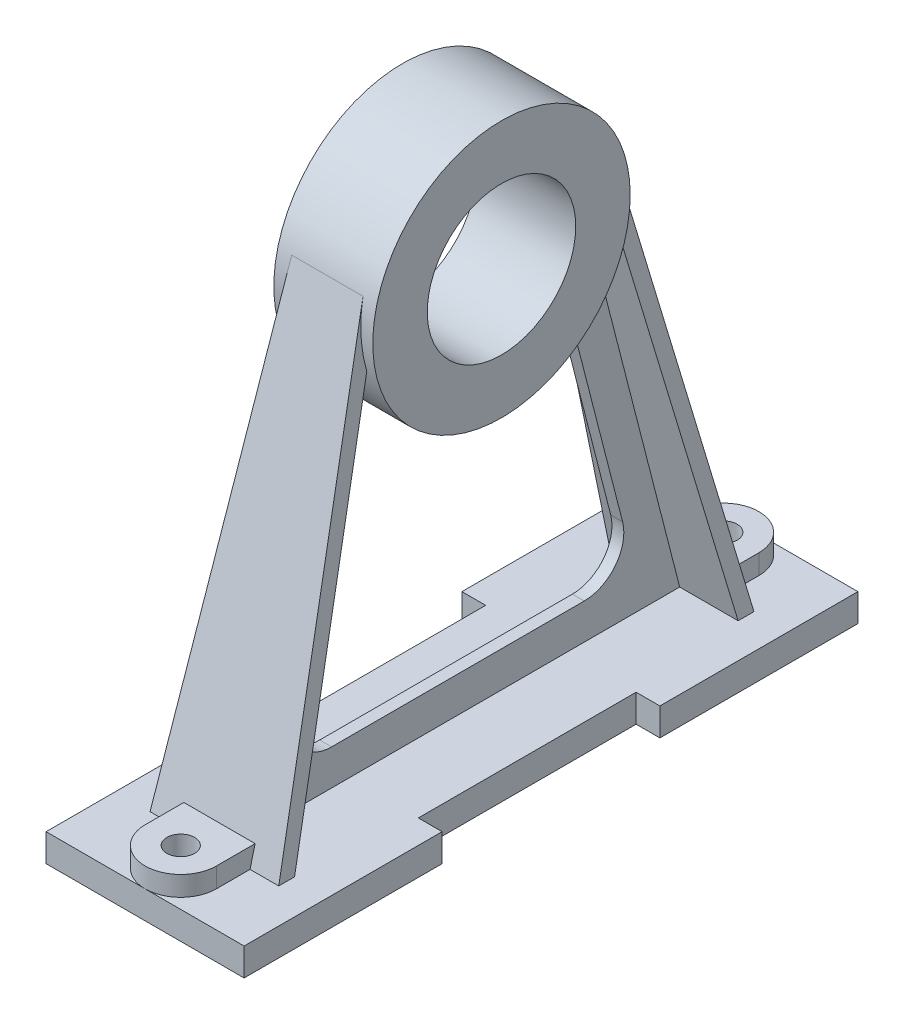
from build123d import *

# Parameters (mm, degrees)
SKETCH1_W             = 100
SKETCH1_H             = 14
BOSS_EXTRUDE1_DEPTH   = 310
SKETCH2_W             = 12
SKETCH2_H             = 110
CUT_EXTRUDE1_DEPTH    = 315.318309998
SKETCH3_R             = 65
SKETCH3_R_2           = 37.5
BOSS_EXTRUDE2_DEPTH   = 25
BOSS_EXTRUDE4_DEPTH   = 3
FILLET1_R             = 20
BOSS_EXTRUDE5_REACH   = 338.253
BOSS_EXTRUDE6_REACH   = 338.253
SKETCH8_R             = 7
BOSS_EXTRUDE7_DEPTH   = 10
BOSS_EXTRUDE8_REACH   = 401.187
SKETCH9_W             = 36
SKETCH9_H             = 10
BOSS_EXTRUDE9_REACH   = 401.187
SKETCH10_W            = 36
SKETCH10_H            = 10
M6_TAPPED_HOLE1_D     = 5
M6_TAPPED_HOLE1_DEPTH = 12


with BuildPart() as part:
    # Sketch1 → Boss-Extrude1 (new body)
    with BuildSketch(Plane.XY):
        with Locations((0, 7)):
            Rectangle(SKETCH1_W, SKETCH1_H)
    extrude(amount=-BOSS_EXTRUDE1_DEPTH)

    # Sketch2 → Cut-Extrude1 (cut, through all)
    with BuildSketch(Plane(origin=(0, 14, 0), x_dir=(1, 0, 0), z_dir=(0, 1, 0))):
        with Locations((44, 155)):
            Rectangle(SKETCH2_W, SKETCH2_H)
        with Locations((-44, 155)):
            Rectangle(SKETCH2_W, SKETCH2_H)
    extrude(amount=-CUT_EXTRUDE1_DEPTH, mode=Mode.SUBTRACT)



with BuildPart() as body_2:
    # Sketch3 → Boss-Extrude2 (new, symmetric)
    with BuildSketch(Plane(origin=(0, 0, 0), x_dir=(0, 0, -1), z_dir=(1, 0, 0))):
        with Locations((155, 220)):
            Circle(SKETCH3_R)
        with Locations((155, 220)):
            Circle(SKETCH3_R_2, mode=Mode.SUBTRACT)
    extrude(amount=BOSS_EXTRUDE2_DEPTH, both=True)


with BuildPart() as part_1:
    add(part.part)

    add(body_2.part)  # Boss-Extrude4 merges body 2
    # Sketch4 → Boss-Extrude4 (add, symmetric)
    with BuildSketch(Plane(origin=(0, 0, 0), x_dir=(0, 0, -1), z_dir=(1, 0, 0))):
        with BuildLine():
            Line((35, 14), (92.042084842, 236.164804946))
            ThreePointArc((92.042084842, 236.164804946), (91.329913301, 206.918713377), (103.515132178, 180.322444817))
            Line((103.515132178, 180.322444817), (65.432495807, 32))
            Line((65.432495807, 32), (244.567504193, 32))
            Line((244.567504193, 32), (206.484867822, 180.322444817))
            ThreePointArc((206.484867822, 180.322444817), (218.670086699, 206.918713377), (217.957915158, 236.164804946))
            Line((217.957915158, 236.164804946), (275, 14))
            Line((275, 14), (35, 14))
        make_face()
    extrude(amount=BOSS_EXTRUDE4_DEPTH, both=True)

    # Fillet1
    fillet1_edges = [part_1.edges().sort_by_distance(p)[0] for p in [
        (0, 32, -65.432495807),
        (0, 32, -244.567504193),
    ]]
    fillet(fillet1_edges, radius=FILLET1_R)

    # Boss-Extrude5: from a plane face, 338.253 long prism both ways, kept between that surface and its translate by the depth
    boss_extrude5_start = Plane(origin=(3, 14, -35), z_dir=(0, 0.24868930686797658, 0.9685833101233602)) * Box(1355.012, 1355.012, 677.506, align=(Align.CENTER, Align.CENTER, Align.MIN), mode=Mode.PRIVATE)
    boss_extrude5_end = Plane(origin=(3, 14, -43), z_dir=(0, 0.24868930686797658, 0.9685833101233602)) * Box(1355.012, 1355.012, 677.506, align=(Align.CENTER, Align.CENTER, Align.MIN), mode=Mode.PRIVATE)
    # Sketch7 → Boss-Extrude5 (add, from a surface)
    with BuildSketch(Plane.XY.offset(-155), mode=Mode.PRIVATE) as boss_extrude5_sk1:
        Polygon((-32.5, 14), (-18, 236.164804946), (18, 236.164804946), (32.5, 14), align=None)
    boss_extrude5_tool1 = extrude(boss_extrude5_sk1.sketch, amount=BOSS_EXTRUDE5_REACH, both=True, mode=Mode.PRIVATE)
    add(((boss_extrude5_tool1 - boss_extrude5_start) & boss_extrude5_end).solids().sort_by_distance((0, 125.082402, -63.521042))[0])

    # Boss-Extrude6: from a plane face, 338.253 long prism both ways, kept between that surface and its translate by the depth
    boss_extrude6_start = Plane(origin=(3, 14, -275), z_dir=(0, -0.2486893068679767, 0.9685833101233602)) * Box(1355.012, 1355.012, 677.506, align=(Align.CENTER, Align.CENTER, Align.MIN), mode=Mode.PRIVATE)
    boss_extrude6_end = Plane(origin=(3, 14, -267), z_dir=(0, -0.2486893068679767, 0.9685833101233602)) * Box(1355.012, 1355.012, 677.506, align=(Align.CENTER, Align.CENTER, Align.MIN), mode=Mode.PRIVATE)
    # Sketch7<2> → Boss-Extrude6 (add, from a surface)
    with BuildSketch(Plane.XY.offset(-155), mode=Mode.PRIVATE) as boss_extrude6_sk1:
        Polygon((-32.5, 14), (-18, 236.164804946), (18, 236.164804946), (32.5, 14), align=None)
    boss_extrude6_tool1 = extrude(boss_extrude6_sk1.sketch, amount=BOSS_EXTRUDE6_REACH, both=True, mode=Mode.PRIVATE)
    add(((boss_extrude6_tool1 & boss_extrude6_start) - boss_extrude6_end).solids().sort_by_distance((0, 125.082402, -246.478958))[0])

    # Sketch8 → Boss-Extrude7 (add)
    # profile 1 of 2: a face of its own
    with BuildSketch(Plane(origin=(0, 14, 0), x_dir=(1, 0, 0), z_dir=(0, 1, 0))):
        with BuildLine():
            Line((-18, 275), (-18, 292))
            ThreePointArc((-18, 292), (0, 310), (18, 292))
            Line((18, 292), (18, 275))
            Line((18, 275), (-18, 275))
        make_face()
        with Locations((0, 292)):
            Circle(SKETCH8_R, mode=Mode.SUBTRACT)
    # profile 2 of 2: a face of its own
    with BuildSketch(Plane(origin=(0, 14, 0), x_dir=(1, 0, 0), z_dir=(0, 1, 0))):
        with BuildLine():
            Line((18, 18), (18, 35))
            Line((18, 35), (-18, 35))
            Line((-18, 35), (-18, 18))
            ThreePointArc((-18, 18), (0, 0), (18, 18))
        make_face()
        with Locations((0, 18)):
            Circle(SKETCH8_R, mode=Mode.SUBTRACT)
    extrude(amount=BOSS_EXTRUDE7_DEPTH)

    # Sketch9 → Boss-Extrude8 (add, up to next)
    with BuildSketch(Plane.XY.offset(-275), mode=Mode.PRIVATE) as boss_extrude8_sk1:
        with Locations((0, 19)):
            Rectangle(SKETCH9_W, SKETCH9_H)
    boss_extrude8_tool1 = extrude(boss_extrude8_sk1.sketch, amount=BOSS_EXTRUDE8_REACH, mode=Mode.PRIVATE) - part_1.part
    add(boss_extrude8_tool1.solids().sort_by_distance((0, 19, -275))[0])

    # Sketch10 → Boss-Extrude9 (add, up to next)
    with BuildSketch(Plane(origin=(0, 0, -35), x_dir=(-1, 0, 0), z_dir=(0, 0, -1)), mode=Mode.PRIVATE) as boss_extrude9_sk1:
        with Locations((0, 19)):
            Rectangle(SKETCH10_W, SKETCH10_H)
    boss_extrude9_tool1 = extrude(boss_extrude9_sk1.sketch, amount=BOSS_EXTRUDE9_REACH, mode=Mode.PRIVATE) - part_1.part
    add(boss_extrude9_tool1.solids().sort_by_distance((0, 19, -35))[0])

    # M6 Tapped Hole1
    with Locations(Plane.ZY.offset(25)):
        with Locations((-117.876893988, 257.123106012), (-117.876893988, 182.876893988), (-192.123106012, 182.876893988), (-192.123106012, 257.123106012)):
            Hole(M6_TAPPED_HOLE1_D / 2, depth=M6_TAPPED_HOLE1_DEPTH)


solid = part_1.part
